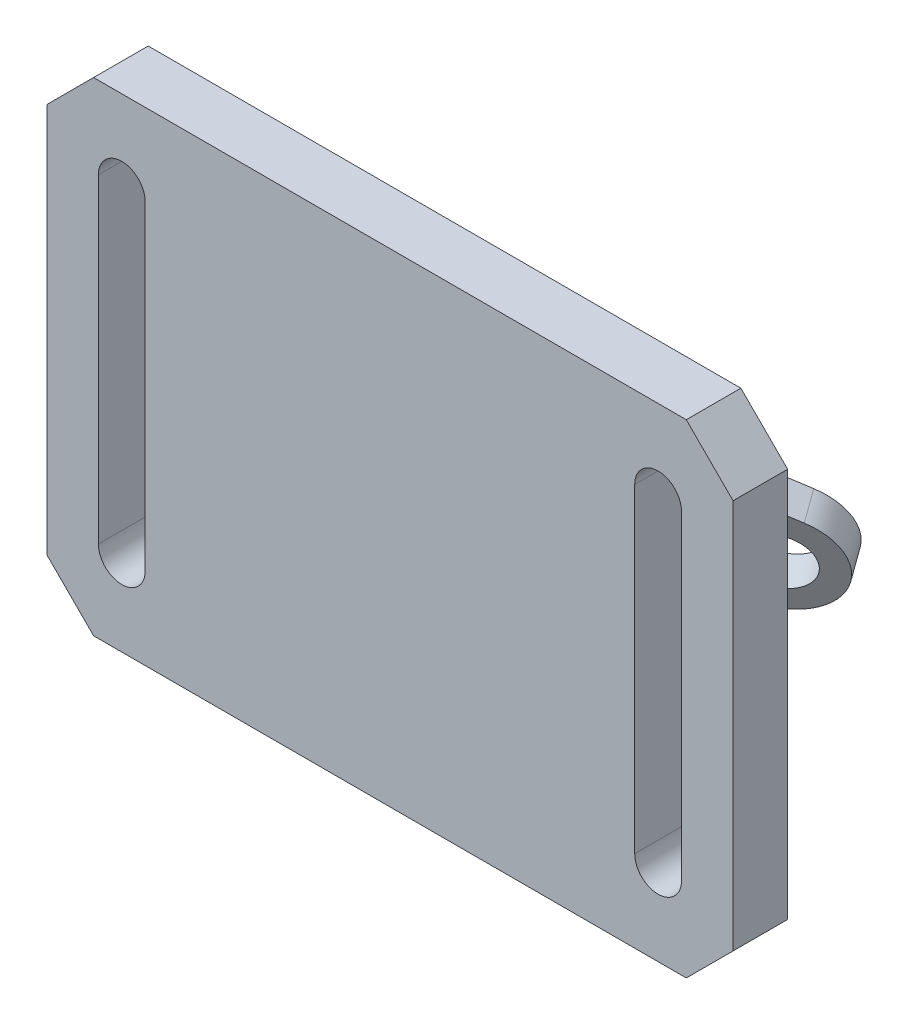
from build123d import *

# Parameters (mm, degrees)
BOSS_EXTRUDE1_DEPTH = 7
BOSS_EXTRUDE2_DEPTH = 7
FILLET1_R           = 7
CUT_EXTRUDE1_REACH  = 66.771
SKETCH6_R           = 4


with BuildPart() as part:
    # Sketch1 → Boss-Extrude1 (new body)
    with BuildSketch(Plane.XY):
        Polygon((-44, 25), (-38, 31), (38, 31), (44, 25), (44, -25), (38, -31), (-38, -31), (-44, -25), align=None)
        with BuildLine():
            Line((-31.385621722, 20.5), (-31.385621722, -20.5))
            ThreePointArc((-31.385621722, -20.5), (-34.385621722, -23.5), (-37.385621722, -20.5))
            Line((-37.385621722, -20.5), (-37.385621722, 20.5))
            ThreePointArc((-37.385621722, 20.5), (-34.385621722, 23.5), (-31.385621722, 20.5))
        make_face(mode=Mode.SUBTRACT)
        with BuildLine():
            Line((31.385621722, 20.5), (31.385621722, -20.5))
            ThreePointArc((31.385621722, -20.5), (34.385621722, -23.5), (37.385621722, -20.5))
            Line((37.385621722, -20.5), (37.385621722, 20.5))
            ThreePointArc((37.385621722, 20.5), (34.385621722, 23.5), (31.385621722, 20.5))
        make_face(mode=Mode.SUBTRACT)
    extrude(amount=BOSS_EXTRUDE1_DEPTH)

    # Sketch2 → Boss-Extrude2 (add, symmetric)
    with BuildSketch(Plane(origin=(0, 0, 0), x_dir=(-0.8589373126285005, 0.5120807484904403, 0), z_dir=(-0.5120807484904403, -0.8589373126285005, 0))):
        Polygon((20.032748859, 0), (-14.300096017, 0), (-14.300096017, 20), (-26.435350933, 28.816778784), (-24.084209923, 32.052846762), (-14.300096017, 24.94427191), align=None)
    extrude(amount=BOSS_EXTRUDE2_DEPTH, both=True)

    # Fillet1
    fillet1_edges = [part.edges().sort_by_distance(p)[0] for p in [
        (25.281133158, -6.92248608, -30.434812773),
        (18.112002679, -18.947608457, -30.434812773),
    ]]
    fillet(fillet1_edges, radius=FILLET1_R - 0.0001)  # a hair under: the kernel refuses the full size

    # Sketch6 → Cut-Extrude1 (cut, up to next)
    with BuildSketch(Plane(origin=(-5.944829265, 3.544184861, -9.526138171), x_dir=(-0.8631949903821312, -0.17604689815365596, 0.4731827323874666), z_dir=(-0.5048706850067575, 0.30099351194556917, -0.8090169943749512)), mode=Mode.PRIVATE) as cut_extrude1_sk1:
        with Locations(Location((-25.217235821, -18.583042284, 0), (0, 0, 10.638271161))):
            Circle(SKETCH6_R)
    cut_extrude1_tool1 = extrude(cut_extrude1_sk1.sketch, amount=-CUT_EXTRUDE1_REACH, mode=Mode.PRIVATE) & part.part
    add(cut_extrude1_tool1.solids().sort_by_distance((15.822562, -9.433086, -27.93835))[0], mode=Mode.SUBTRACT)


solid = part.part
